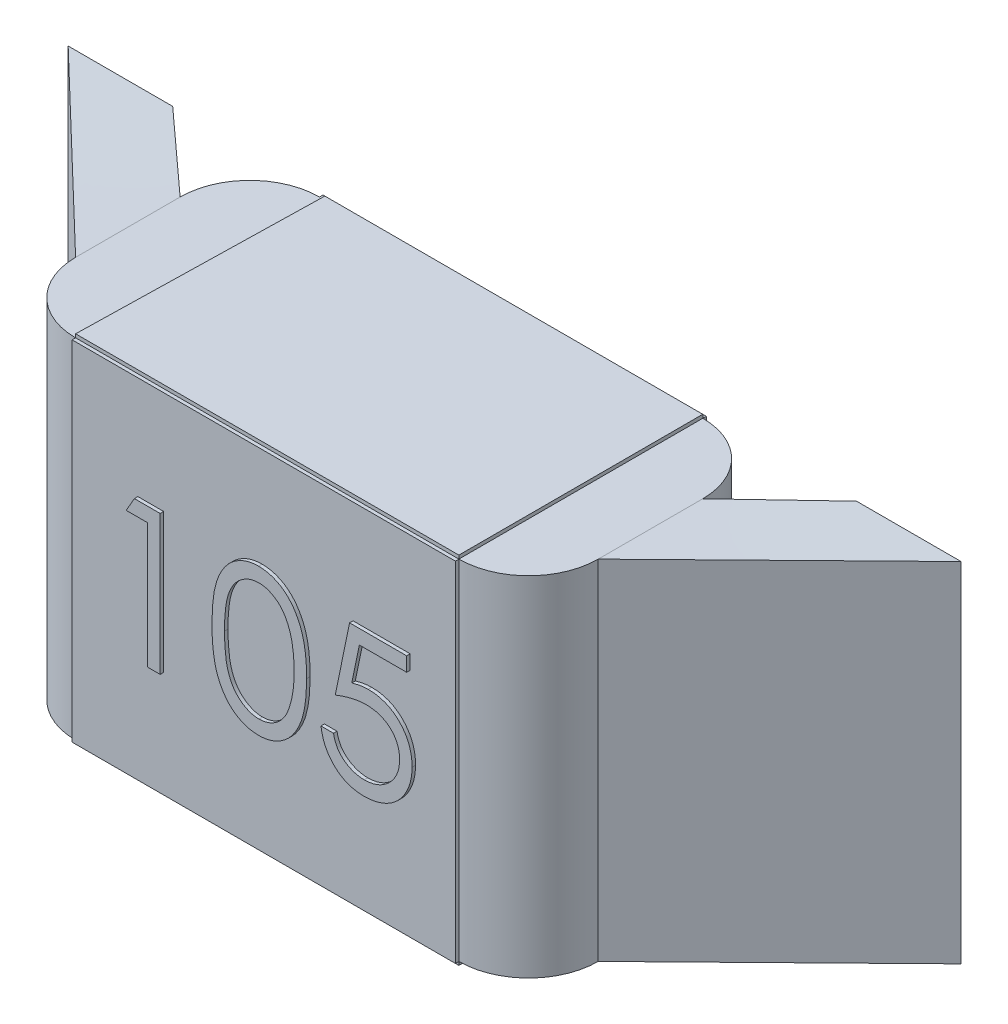
from build123d import *

# Parameters (mm, degrees)
BOSS_EXTRU_1_DEPTH      = 0.35
BOSS_EXTRU_1_DEPTH_BACK = 0.35
ESQUISSE1_W             = 1.5
ESQUISSE1_H             = 1
ESQUISSE2_W             = 1.1
ESQUISSE2_H             = 1
BOSS_EXTRU_2_DEPTH      = 0.01
BOSS_EXTRU_3_DEPTH      = 0.01
CONG_1_R                = 0.2
BOSS_EXTRU_4_DEPTH      = 0.01


with BuildPart() as part:
    # Esquisse1 → Boss.-Extru.1 (new, two sides: drawn at the far end of the back side and taken through both)
    with BuildSketch(Plane.XY.offset(-BOSS_EXTRU_1_DEPTH_BACK)):
        Rectangle(ESQUISSE1_W, ESQUISSE1_H)
    extrude(amount=BOSS_EXTRU_1_DEPTH + BOSS_EXTRU_1_DEPTH_BACK)

    # Esquisse2 → Boss.-Extru.2 (add)
    with BuildSketch(Plane.XY.offset(0.35)):
        Rectangle(ESQUISSE2_W, ESQUISSE2_H)
    boss_extru_2 = extrude(amount=BOSS_EXTRU_2_DEPTH)

    # Esquisse3 → Boss.-Extru.3 (add)
    with BuildSketch(Plane.XZ.offset(0.5)):
        Polygon((-0.55, 0.35), (-0.534610183, -0.35), (0.55, -0.35), (0.55, 0.35), align=None)
    boss_extru_3 = extrude(amount=BOSS_EXTRU_3_DEPTH)

    # Symétrie1: Boss.-Extru.2 across plane
    add(boss_extru_2.mirror(Plane.XY))

    # Symétrie2: Boss.-Extru.3 across plane
    add(boss_extru_3.mirror(Plane.ZX))

    # Congé1
    cong_1_edges = [part.edges().sort_by_distance(p)[0] for p in [
        (-0.75, 0, 0.35),
        (-0.75, 0, -0.35),
        (0.75, 0, -0.35),
        (0.75, 0, 0.35),
    ]]
    fillet(cong_1_edges, radius=CONG_1_R - 0.0001)  # a hair under: the kernel refuses the full size

    # Lissage3: read off the stored shape, not the designer's step
    # Lissage3: loft between two sections, ruled curve by curve
    lissage3_from = [
        Edge.make_bspline([(-0.75, -0.5, -0.15), (-0.75, -0.5, -0.1), (-0.75, -0.5, -0.05), (-0.75, -0.5, 0.05), (-0.75, -0.5, 0.1), (-0.75, -0.5, 0.15)], [0, 0, 0, 0, 0.5, 0.5, 1, 1, 1, 1], 3),
        Edge.make_bspline([(-0.75, 0.5, 0.15), (-0.75, 0.5, 0.1), (-0.75, 0.5, 0.05), (-0.75, 0.5, -0.05), (-0.75, 0.5, -0.1), (-0.75, 0.5, -0.15)], [0, 0, 0, 0, 0.5, 0.5, 1, 1, 1, 1], 3),
        Edge.make_line((-0.75, 0.5, 0.15), (-0.75, -0.5, 0.15)),
        Edge.make_line((-0.75, -0.5, -0.15), (-0.75, 0.5, -0.15)),
    ]
    lissage3_to = [
        Edge.make_bspline([(-0.981354224, -0.495363438, -0.36), (-1.031354224, -0.495363438, -0.36), (-1.081354224, -0.495363438, -0.36), (-1.181354224, -0.495363438, -0.36), (-1.231354224, -0.495363438, -0.36), (-1.281354224, -0.495363438, -0.36)], [0, 0, 0, 0, 0.5, 0.5, 1, 1, 1, 1], 3),
        Edge.make_bspline([(-1.281354224, 0.504636562, -0.36), (-1.231354224, 0.504636562, -0.36), (-1.181354224, 0.504636562, -0.36), (-1.081354224, 0.504636562, -0.36), (-1.031354224, 0.504636562, -0.36), (-0.981354224, 0.504636562, -0.36)], [0, 0, 0, 0, 0.5, 0.5, 1, 1, 1, 1], 3),
        Edge.make_line((-1.281354224, 0.504636562, -0.36), (-1.281354224, -0.495363438, -0.36)),
        Edge.make_line((-0.981354224, -0.495363438, -0.36), (-0.981354224, 0.504636562, -0.36)),
    ]
    lissage3 = Solid(Shell([*[Face.make_surface_from_curves(lissage3_from[k], lissage3_to[k]) for k in range(4)], Face(Wire(lissage3_from)), Face(Wire(lissage3_to))]))
    add(lissage3)

    # Symétrie6: Lissage3 across plane
    add(lissage3.mirror(Plane(origin=(0, 0, 0), x_dir=(0, 0, 1), z_dir=(1, 0, 0))))

    # Esquisse7 → Boss.-Extru.4 (add)
    # profile 1 of 3: a face of its own
    with BuildSketch(Plane.XY.offset(0.36)):
        Polygon((-0.361299758, 0.204766689), (-0.287341424, 0.204766689), (-0.287341424, -0.195233311), (-0.32323886, -0.195233311), (-0.32323886, 0.163741048), (-0.384777322, 0.163741048), align=None)
    # profile 2 of 3: a face of its own
    with BuildSketch(Plane.XY.offset(0.36)):
        with BuildLine():
            add(Edge.make_bspline(
                [(-0.138623476, 0.004606432), (-0.138585988, 0.011017562), (-0.138513167, 0.023471275), (-0.137703062, 0.041618091), (-0.136357309, 0.058642124), (-0.134513037, 0.074544189), (-0.132268697, 0.08932839), (-0.129272641, 0.10295522), (-0.125865464, 0.115487746), (-0.121916613, 0.126966837), (-0.117460866, 0.137547146), (-0.112611236, 0.147424312), (-0.107175259, 0.15658339), (-0.101463612, 0.165170566), (-0.09524509, 0.173045274), (-0.088696656, 0.180318721), (-0.081562728, 0.186822807), (-0.074085812, 0.192748099), (-0.066198216, 0.197942324), (-0.058124769, 0.202517494), (-0.0498099, 0.20642605), (-0.041230907, 0.209499243), (-0.032464901, 0.212037626), (-0.023481236, 0.213773505), (-0.01426508, 0.214865723), (-0.008044345, 0.214970143), (-0.004889501, 0.215023099)],
                knots=[0, 0, 0, 0, 1.646270934, 3.197905019, 4.663502075, 6.030701355, 7.308322542, 8.50163776, 9.611534131, 10.641858119, 11.616356847, 12.558055219, 13.465016945, 14.349605745, 15.204443733, 16.039544428, 16.859896111, 17.680448484, 18.487036065, 19.28249412, 20.06191084, 20.843045899, 21.620316918, 22.403196591, 23.190181807, 24, 24, 24, 24], degree=3))
            add(Edge.make_bspline(
                [(-0.004889501, 0.215023099), (-0.001708304, 0.214967348), (0.004618097, 0.214856479), (0.013971283, 0.213790885), (0.023108389, 0.212022757), (0.031990462, 0.209517503), (0.040690461, 0.206409425), (0.049140336, 0.202513755), (0.057392574, 0.197979027), (0.065316035, 0.192650584), (0.072997706, 0.186709752), (0.080248902, 0.179994019), (0.087070283, 0.172571194), (0.093547461, 0.164520695), (0.099496672, 0.155688114), (0.105162207, 0.146227073), (0.110233297, 0.135972117), (0.115117259, 0.125094349), (0.119332915, 0.113292788), (0.123134772, 0.100633958), (0.126206654, 0.086968337), (0.128765428, 0.072367623), (0.130747702, 0.056778197), (0.132191432, 0.040233475), (0.13295407, 0.022722573), (0.133097693, 0.010750247), (0.133171396, 0.004606432)],
                knots=[0, 0, 0, 0, 0.810914788, 1.612654377, 2.396697861, 3.181598691, 3.963628158, 4.749916497, 5.551656086, 6.361998678, 7.18212741, 8.025565596, 8.878627764, 9.750805457, 10.657531673, 11.591944965, 12.560506719, 13.57287815, 14.630710178, 15.753379473, 16.941251878, 18.199788006, 19.531962791, 20.947069417, 22.433333509, 24, 24, 24, 24], degree=3))
            add(Edge.make_bspline(
                [(0.133171396, 0.004606432), (0.133096929, -0.001510586), (0.132951834, -0.013429346), (0.132199982, -0.030861458), (0.130718995, -0.047318377), (0.128866425, -0.062839573), (0.126300601, -0.077360443), (0.123145725, -0.090931237), (0.119642831, -0.10361056), (0.115318854, -0.115294538), (0.110586201, -0.126146164), (0.105437036, -0.136279552), (0.099920485, -0.145784271), (0.093910342, -0.154584242), (0.087504238, -0.162741803), (0.080565062, -0.17011296), (0.073288424, -0.176875323), (0.065584148, -0.182892651), (0.057537113, -0.188159486), (0.049313219, -0.192869641), (0.040766546, -0.196667663), (0.03209078, -0.19992881), (0.023161824, -0.202420291), (0.013990808, -0.204143017), (0.004624381, -0.205351228), (-0.001707226, -0.205443397), (-0.004889501, -0.205489722)],
                knots=[0, 0, 0, 0, 1.561518951, 3.042555995, 4.452378317, 5.7783523, 7.031515105, 8.214008947, 9.334062868, 10.386615937, 11.391082383, 12.354592575, 13.286541444, 14.194233754, 15.072674879, 15.931287219, 16.775624067, 17.606195743, 18.42308326, 19.229000347, 20.022332153, 20.807536673, 21.593273796, 22.3848459, 23.188221202, 24, 24, 24, 24], degree=3))
            add(Edge.make_bspline(
                [(-0.004889501, -0.205489722), (-0.008044257, -0.205436424), (-0.01426482, -0.205331331), (-0.02348224, -0.204244048), (-0.032428805, -0.20249599), (-0.041148663, -0.200048378), (-0.04968655, -0.197052397), (-0.057926126, -0.193149119), (-0.065959004, -0.188653797), (-0.073763753, -0.18353432), (-0.081193714, -0.177668985), (-0.088290698, -0.171181637), (-0.094876414, -0.16391039), (-0.101006025, -0.155970056), (-0.106831635, -0.147433686), (-0.112190421, -0.138184729), (-0.11714709, -0.128259859), (-0.121677774, -0.117594955), (-0.125694765, -0.106034392), (-0.129243074, -0.093445914), (-0.132044692, -0.079718413), (-0.134442744, -0.064962142), (-0.136376959, -0.049113693), (-0.137697454, -0.032164461), (-0.138513604, -0.014125009), (-0.138586183, -0.001751321), (-0.138623476, 0.004606432)],
                knots=[0, 0, 0, 0, 0.810891512, 1.598919785, 2.382837074, 3.152667961, 3.926044502, 4.706494248, 5.493654104, 6.291793342, 7.103789334, 7.925228297, 8.761435821, 9.622817696, 10.50288917, 11.416980706, 12.369136599, 13.353924996, 14.394355917, 15.514179734, 16.714354668, 17.994756427, 19.357759367, 20.818452758, 22.365282078, 24, 24, 24, 24], degree=3))
        make_face()
        with BuildLine():
            add(Edge.make_bspline(
                [(-0.10272604, 0.004766689), (-0.102712389, -0.00057602), (-0.102685895, -0.010945168), (-0.101993757, -0.026012969), (-0.101050874, -0.040066721), (-0.099834725, -0.053124268), (-0.098028674, -0.065141412), (-0.096005041, -0.076200805), (-0.093542402, -0.086243917), (-0.090628686, -0.095339667), (-0.087309932, -0.103642418), (-0.083686405, -0.111368271), (-0.079793751, -0.118608492), (-0.075437277, -0.125298048), (-0.070692698, -0.131458752), (-0.065667183, -0.137199647), (-0.060173173, -0.142319302), (-0.052572745, -0.148459514), (-0.042538862, -0.154804558), (-0.029896525, -0.160329826), (-0.016905845, -0.163802106), (-0.008088559, -0.164243678), (-0.003687578, -0.164464081)],
                knots=[0, 0, 0, 0, 1.459021318, 2.831673884, 4.118529203, 5.306027144, 6.411944654, 7.436330062, 8.375795394, 9.233974572, 10.042671642, 10.816086306, 11.563610507, 12.285937304, 12.993564865, 13.685989202, 14.367179055, 15.041617293, 16.353048772, 17.594441528, 18.799311195, 20, 20, 20, 20], degree=3))
            add(Edge.make_bspline(
                [(-0.003687578, -0.164464081), (0.00074187, -0.164281477), (0.009591621, -0.163916647), (0.022521198, -0.160396791), (0.035073229, -0.155085987), (0.044910022, -0.148806272), (0.052393741, -0.142825892), (0.057755683, -0.137727075), (0.06267706, -0.132017833), (0.067344725, -0.125857913), (0.071625763, -0.119129629), (0.075518693, -0.111865335), (0.079071075, -0.104044857), (0.081094966, -0.098585459), (0.082129729, -0.095794209)],
                knots=[0, 0, 0, 0, 1.353760809, 2.704726607, 4.075137775, 5.516104923, 6.260822281, 7.007110065, 7.778089737, 8.566572457, 9.372053459, 10.217411131, 11.088608312, 12, 12, 12, 12], degree=3))
            add(Edge.make_bspline(
                [(0.082129729, -0.095794209), (0.083335646, -0.092225096), (0.085784173, -0.084978266), (0.088939804, -0.073736705), (0.091424993, -0.061942104), (0.093660806, -0.049664948), (0.09518687, -0.036814696), (0.096415191, -0.023431109), (0.097138698, -0.009504096), (0.097228384, -4.1812e-05), (0.09727396, 0.004766689)],
                knots=[0, 0, 0, 0, 0.884706709, 1.796334032, 2.740027952, 3.714592787, 4.726048262, 5.777819803, 6.87074269, 8, 8, 8, 8], degree=3))
            add(Edge.make_bspline(
                [(0.09727396, 0.004766689), (0.097211081, 0.009574411), (0.097088077, 0.018979344), (0.096617907, 0.032752851), (0.095403784, 0.04583488), (0.094055314, 0.058281792), (0.09206706, 0.070024683), (0.08992331, 0.081161861), (0.087043172, 0.09155535), (0.083966626, 0.101367873), (0.080445438, 0.110487948), (0.076569354, 0.118958095), (0.072429725, 0.126819206), (0.067933469, 0.134049714), (0.063133962, 0.140682005), (0.057904528, 0.146583101), (0.052452599, 0.151935898), (0.04481635, 0.158045905), (0.034819288, 0.164275813), (0.022379785, 0.170009043), (0.009434569, 0.173301419), (0.000683317, 0.173765612), (-0.003687578, 0.173997458)],
                knots=[0, 0, 0, 0, 1.31362396, 2.569729283, 3.763502607, 4.902122613, 5.988968491, 7.01645872, 7.998833611, 8.933434873, 9.825090667, 10.667526885, 11.477055099, 12.250526234, 12.991942729, 13.710640831, 14.402115721, 15.076753259, 16.378508321, 17.609869233, 18.806226677, 20, 20, 20, 20], degree=3))
            add(Edge.make_bspline(
                [(-0.003687578, 0.173997458), (-0.008111646, 0.173765292), (-0.016967841, 0.173300539), (-0.030047607, 0.17002131), (-0.042585247, 0.164305542), (-0.052555873, 0.158025271), (-0.060197449, 0.15204375), (-0.065578328, 0.146856727), (-0.070623605, 0.141182869), (-0.075271342, 0.134965507), (-0.079624403, 0.128283751), (-0.083622233, 0.121085035), (-0.087224213, 0.113332879), (-0.09054816, 0.105033858), (-0.093470765, 0.095938893), (-0.095881503, 0.085908151), (-0.098108595, 0.074883934), (-0.099685197, 0.062801705), (-0.101086769, 0.049740887), (-0.101987495, 0.035652051), (-0.10268821, 0.020558979), (-0.102713177, 0.010136218), (-0.10272604, 0.004766689)],
                knots=[0, 0, 0, 0, 1.207732386, 2.417664972, 3.655092373, 4.956220595, 5.625982001, 6.301752483, 6.994047911, 7.697131622, 8.419323945, 9.170223765, 9.943494443, 10.752040957, 11.610060368, 12.549350801, 13.567764191, 14.679664412, 15.874934091, 17.154273443, 18.533957287, 20, 20, 20, 20], degree=3))
        make_face(mode=Mode.SUBTRACT)
    # profile 3 of 3: a face of its own
    with BuildSketch(Plane.XY.offset(0.36)):
        with BuildLine():
            Line((0.420350883, 0.204766689), (0.420350883, 0.163741048))
            Line((0.420350883, 0.163741048), (0.284293191, 0.163741048))
            Line((0.284293191, 0.163741048), (0.262738704, 0.058532714))
            add(Edge.make_bspline(
                [(0.262738704, 0.058532714), (0.266973661, 0.059701888), (0.27517822, 0.061966978), (0.287287919, 0.064481923), (0.298784171, 0.065997974), (0.306244213, 0.066204981), (0.309854088, 0.06630515)],
                knots=[0, 0, 0, 0, 1.100273476, 2.13160584, 3.095893838, 4, 4, 4, 4], degree=3))
            add(Edge.make_bspline(
                [(0.309854088, 0.06630515), (0.314320802, 0.066208472), (0.323103476, 0.066018378), (0.335953641, 0.064193024), (0.348220257, 0.061319891), (0.359877671, 0.057306117), (0.370947448, 0.052173576), (0.381327741, 0.045762154), (0.39117436, 0.03827263), (0.400310656, 0.029661772), (0.408599148, 0.020185016), (0.41588669, 0.009995545), (0.4220767, -0.000807617), (0.427055072, -0.012327686), (0.431030425, -0.024437304), (0.433676367, -0.037263885), (0.435438277, -0.050686527), (0.435635121, -0.059864192), (0.435735499, -0.064544209)],
                knots=[0, 0, 0, 0, 1.052922333, 2.070308379, 3.05430497, 4.020497103, 4.973039431, 5.925935799, 6.892292201, 7.88610001, 8.88166317, 9.857072816, 10.836096531, 11.812156883, 12.81219415, 13.836441305, 14.89672472, 16, 16, 16, 16], degree=3))
            add(Edge.make_bspline(
                [(0.435735499, -0.064544209), (0.43565949, -0.067803891), (0.4355085, -0.074279204), (0.434740661, -0.083895684), (0.433262294, -0.093308579), (0.431277411, -0.102519138), (0.428701135, -0.111509924), (0.425582386, -0.12030667), (0.421765697, -0.128854625), (0.417579254, -0.13723467), (0.412865371, -0.145257357), (0.407633541, -0.152760098), (0.402106057, -0.159855444), (0.39615847, -0.1664673), (0.389735499, -0.172552216), (0.382914931, -0.178146305), (0.375751192, -0.183344172), (0.36813345, -0.187934822), (0.360231452, -0.19215916), (0.351931084, -0.195624707), (0.34342129, -0.198723053), (0.33457959, -0.201192714), (0.325426011, -0.203127863), (0.315945466, -0.204442217), (0.306187675, -0.205399524), (0.299573388, -0.205459451), (0.296232294, -0.205489722)],
                knots=[0, 0, 0, 0, 1.056347294, 2.098418968, 3.122841568, 4.141288669, 5.149314143, 6.15115421, 7.162517403, 8.180376062, 9.185164535, 10.17417709, 11.141909838, 12.097768115, 13.052685741, 14.0056014, 14.954263652, 15.917497458, 16.885230207, 17.854509472, 18.828990115, 19.81800267, 20.826176721, 21.857883937, 22.917946725, 24, 24, 24, 24], degree=3))
            add(Edge.make_bspline(
                [(0.296232294, -0.205489722), (0.292246673, -0.205410769), (0.284405435, -0.205255438), (0.27291737, -0.203630469), (0.261864273, -0.201303164), (0.251335118, -0.197801876), (0.241235545, -0.193414756), (0.23170152, -0.187870051), (0.222489432, -0.181586725), (0.21397377, -0.174171827), (0.206070214, -0.166067178), (0.198995185, -0.157272019), (0.192694205, -0.147931511), (0.187268176, -0.138000294), (0.182639831, -0.127504462), (0.179003832, -0.11640469), (0.176069163, -0.104758975), (0.174827629, -0.096741431), (0.174197037, -0.092669209)],
                knots=[0, 0, 0, 0, 1.0467383, 2.05933395, 3.04377827, 4.011590433, 4.970194871, 5.932262533, 6.905835911, 7.896367577, 8.894135286, 9.877477877, 10.858688626, 11.851381753, 12.8477658, 13.868841284, 14.917554742, 16, 16, 16, 16], degree=3))
            Line((0.174197037, -0.092669209), (0.210094473, -0.092669209))
            add(Edge.make_bspline(
                [(0.210094473, -0.092669209), (0.210977737, -0.096483661), (0.212675419, -0.103815249), (0.21640179, -0.114115973), (0.22095789, -0.123295313), (0.22637553, -0.131474694), (0.23283839, -0.138607151), (0.240213182, -0.144963387), (0.248481494, -0.150697687), (0.257669291, -0.155477432), (0.267362215, -0.159553861), (0.277507039, -0.16226834), (0.287827535, -0.164177014), (0.29480792, -0.164368072), (0.298315627, -0.164464081)],
                knots=[0, 0, 0, 0, 1.136247022, 2.183929868, 3.172523383, 4.106158343, 5.02341133, 5.958108904, 6.928429099, 7.938127109, 8.96079061, 9.975095812, 10.982467395, 12, 12, 12, 12], degree=3))
            add(Edge.make_bspline(
                [(0.298315627, -0.164464081), (0.301739449, -0.164370278), (0.308480983, -0.164185578), (0.318402284, -0.162763977), (0.327980899, -0.16057454), (0.337122311, -0.157297985), (0.345986487, -0.153315732), (0.354349203, -0.148205437), (0.362452389, -0.142324292), (0.370044176, -0.135586392), (0.376997256, -0.128161284), (0.383140813, -0.12022101), (0.388258174, -0.111750514), (0.392570644, -0.102896439), (0.395845307, -0.093561747), (0.398181419, -0.083790184), (0.399553197, -0.073557615), (0.399741903, -0.066578265), (0.399838063, -0.063021773)],
                knots=[0, 0, 0, 0, 1.027316725, 2.022795036, 3.002884548, 3.971462791, 4.93288096, 5.914575861, 6.907176829, 7.935150275, 8.956128384, 9.956726525, 10.942570165, 11.921478529, 12.907843606, 13.90538589, 14.932640048, 16, 16, 16, 16], degree=3))
            add(Edge.make_bspline(
                [(0.399838063, -0.063021773), (0.399762808, -0.059813116), (0.399615507, -0.053532625), (0.398412014, -0.044344145), (0.396318645, -0.035650083), (0.393413059, -0.027408456), (0.389723973, -0.019611491), (0.385215823, -0.012251141), (0.379804006, -0.005424418), (0.373622076, 0.000871874), (0.366849728, 0.006682717), (0.359370443, 0.011636327), (0.351340737, 0.015803632), (0.342857354, 0.019399974), (0.333718509, 0.021982917), (0.324105179, 0.023922104), (0.313913556, 0.025043859), (0.306945477, 0.025199504), (0.303363704, 0.025279509)],
                knots=[0, 0, 0, 0, 1.045622112, 2.046656509, 3.013763289, 3.955457236, 4.890082067, 5.820317437, 6.762574623, 7.722996705, 8.69280354, 9.665887285, 10.63943826, 11.638615906, 12.663482002, 13.728887084, 14.832589034, 16, 16, 16, 16], degree=3))
            add(Edge.make_bspline(
                [(0.303363704, 0.025279509), (0.300263255, 0.025213156), (0.293861614, 0.025076153), (0.284041863, 0.024067411), (0.273722809, 0.022440063), (0.262944009, 0.020201634), (0.251673094, 0.017272368), (0.239933848, 0.01376214), (0.227701589, 0.00956534), (0.219459563, 0.006395944), (0.215222678, 0.004766689)],
                knots=[0, 0, 0, 0, 0.817624296, 1.688186739, 2.600797293, 3.572016777, 4.590301741, 5.671205678, 6.80286297, 8, 8, 8, 8], degree=3))
            Line((0.215222678, 0.004766689), (0.256248319, 0.204766689))
            Line((0.256248319, 0.204766689), (0.420350883, 0.204766689))
        make_face()
    extrude(amount=BOSS_EXTRU_4_DEPTH)


solid = part.part
